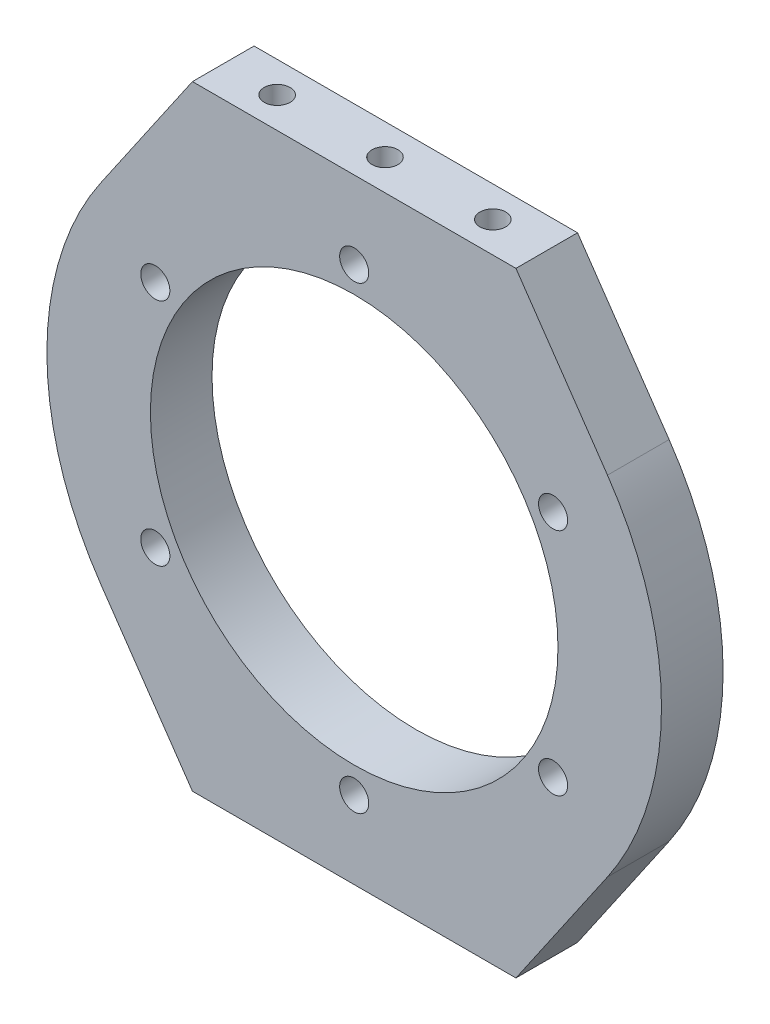
from build123d import *

# Parameters (mm, degrees)
BOSS_EXTRUDE1_DEPTH       = 9.525
M4_CLEARANCE_HOLE1_D      = 4.5
SKETCH4_R                 = 31.5
CUT_EXTRUDE1_DEPTH        = 68.847075287
F_4_0MM_DOWEL_HOLE1_D     = 4
F_4_0MM_DOWEL_HOLE1_DEPTH = 3.2
F_4_0MM_DOWEL_HOLE1_TIP   = 1.201721238
F_4_0MM_DOWEL_HOLE2_D     = 4
F_4_0MM_DOWEL_HOLE2_DEPTH = 3.2
F_4_0MM_DOWEL_HOLE2_TIP   = 1.201721238


with BuildPart() as part:
    # Sketch1 → Boss-Extrude1 (new body)
    with BuildSketch(Plane.XY):
        with BuildLine():
            Line((-25, 47.5), (25, 47.5))
            Line((25, 47.5), (39.154013015, 26.892624729))
            ThreePointArc((39.154013015, 26.892624729), (47.5, 0), (39.154013015, -26.892624729))
            Line((39.154013015, -26.892624729), (25, -47.5))
            Line((25, -47.5), (-25, -47.5))
            Line((-25, -47.5), (-39.154013015, -26.892624729))
            ThreePointArc((-39.154013015, -26.892624729), (-47.5, 0), (-39.154013015, 26.892624729))
            Line((-39.154013015, 26.892624729), (-25, 47.5))
        make_face()
    extrude(amount=-BOSS_EXTRUDE1_DEPTH)

    # M4 Clearance Hole1 (through all)
    with Locations(Plane.XY):
        with Locations((-30.743901834, 17.75), (0, 35.5), (59.233049824, 29.038488654), (30.743901834, 17.75), (30.743901834, -17.75), (0, -35.5), (-30.743901834, -17.75)):
            Hole(M4_CLEARANCE_HOLE1_D / 2)

    # Sketch4 → Cut-Extrude1 (cut, through all)
    with BuildSketch(Plane(origin=(0, 0, -9.525), x_dir=(-1, 0, 0), z_dir=(0, 0, -1))):
        Circle(SKETCH4_R)
    extrude(amount=-CUT_EXTRUDE1_DEPTH, mode=Mode.SUBTRACT)

    # Ø4.0mm Dowel Hole1
    with Locations(Plane(origin=(0, 47.5, 0), x_dir=(1, 0, 0), z_dir=(0, 1, 0))):
        with Locations((16.67, 4.7625), (0, 4.7625), (-16.67, 4.7625)):
            Hole(F_4_0MM_DOWEL_HOLE1_D / 2, depth=F_4_0MM_DOWEL_HOLE1_DEPTH)
            with Locations((0, 0, -(F_4_0MM_DOWEL_HOLE1_DEPTH + F_4_0MM_DOWEL_HOLE1_TIP / 2))):  # 118° drill point
                Cone(0, F_4_0MM_DOWEL_HOLE1_D / 2, F_4_0MM_DOWEL_HOLE1_TIP, mode=Mode.SUBTRACT)

    # Ø4.0mm Dowel Hole2
    with Locations(Plane.XZ.offset(47.5)):
        with Locations((0, -4.7625), (16.67, -4.7625), (-16.67, -4.7625)):
            Hole(F_4_0MM_DOWEL_HOLE2_D / 2, depth=F_4_0MM_DOWEL_HOLE2_DEPTH)
            with Locations((0, 0, -(F_4_0MM_DOWEL_HOLE2_DEPTH + F_4_0MM_DOWEL_HOLE2_TIP / 2))):  # 118° drill point
                Cone(0, F_4_0MM_DOWEL_HOLE2_D / 2, F_4_0MM_DOWEL_HOLE2_TIP, mode=Mode.SUBTRACT)


solid = part.part
